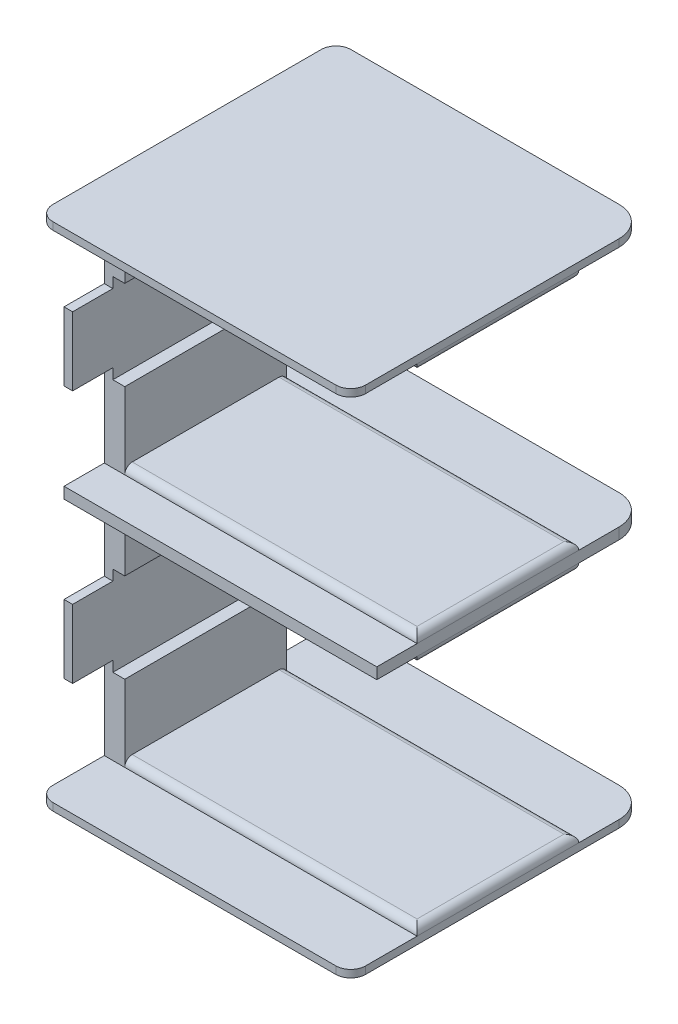
from build123d import *
from OCP.BRepFilletAPI import BRepFilletAPI_MakeFillet

# Parameters (mm, degrees)
SKETCH1_W              = 41.97
SKETCH1_H              = 32.5
BOSS_EXTRUDE1_DEPTH    = 0.75
SKETCH2_W              = 41.97
SKETCH2_H              = 21.7
BOSS_EXTRUDE2_DEPTH    = 1.75
SKETCH4_W              = 2.75
SKETCH4_H              = 21.7
BOSS_EXTRUDE3_DEPTH    = 31.5
SKETCH5_W              = 21.7
SKETCH5_H              = 12
CUT_EXTRUDE1_DEPTH     = 1.6
SKETCH6_W              = 32.5
SKETCH6_H              = 9.2
BOSS_EXTRUDE4_DEPTH    = 1.15
SKETCH7_W              = 41.97
SKETCH7_H              = 21.7
BOSS_EXTRUDE5_DEPTH    = 1
SKETCH8_W              = 41.97
SKETCH8_H              = 40
BOSS_EXTRUDE6_DEPTH    = 1
FILLET1_R              = 4
FILLET1_R_2            = 2
FILLET1_R_3            = 1
FILLET1_OF_MIRROR2_R   = 4
FILLET1_OF_MIRROR2_R_2 = 2
FILLET1_OF_MIRROR2_R_3 = 1
FILLET2_R              = 1
SKETCH9_W              = 41.97
SKETCH9_H              = 1.5
BOSS_EXTRUDE7_DEPTH    = 4
FILLET4_R              = 4
FILLET5_R              = 2


with BuildPart() as part:
    # Sketch1 → Boss-Extrude1 (new, symmetric)
    with BuildSketch(Plane(origin=(0, 0, 0), x_dir=(1, 0, 0), z_dir=(0, 1, 0))):
        Rectangle(SKETCH1_W, SKETCH1_H)
    extrude(amount=BOSS_EXTRUDE1_DEPTH, both=True)

    # Sketch2 → Boss-Extrude2 (add, symmetric)
    with BuildSketch(Plane(origin=(0, 0, 0), x_dir=(1, 0, 0), z_dir=(0, 1, 0))):
        Rectangle(SKETCH2_W, SKETCH2_H)
    extrude(amount=BOSS_EXTRUDE2_DEPTH, both=True)

    # Sketch4 → Boss-Extrude3 (add)
    with BuildSketch(Plane(origin=(0, 0.75, 0), x_dir=(1, 0, 0), z_dir=(0, 1, 0))):
        with Locations((-19.61, 0)):
            Rectangle(SKETCH4_W, SKETCH4_H)
    boss_extrude3 = extrude(amount=BOSS_EXTRUDE3_DEPTH)

    # Sketch5 → Cut-Extrude1 (cut)
    with BuildSketch(Plane(origin=(-18.235, 0, 0), x_dir=(0, 0, -1), z_dir=(1, 0, 0))):
        with Locations((0, 17)):
            Rectangle(SKETCH5_W, SKETCH5_H)
    cut_extrude1 = extrude(amount=-CUT_EXTRUDE1_DEPTH, mode=Mode.SUBTRACT)

    # Sketch6 → Boss-Extrude4 (add)
    with BuildSketch(Plane(origin=(-19.835, 0, 0), x_dir=(0, 0, -1), z_dir=(1, 0, 0))):
        with Locations((0, 17)):
            Rectangle(SKETCH6_W, SKETCH6_H)
    boss_extrude4 = extrude(amount=-BOSS_EXTRUDE4_DEPTH)

    # Sketch7 → Boss-Extrude5 (add)
    with BuildSketch(Plane(origin=(0, 32.25, 0), x_dir=(1, 0, 0), z_dir=(0, 1, 0))):
        Rectangle(SKETCH7_W, SKETCH7_H)
    boss_extrude5 = extrude(amount=BOSS_EXTRUDE5_DEPTH)

    # Sketch8 → Boss-Extrude6 (add)
    with BuildSketch(Plane(origin=(0, 33.25, 0), x_dir=(1, 0, 0), z_dir=(0, 1, 0))):
        with Locations((0, 0.25)):
            Rectangle(SKETCH8_W, SKETCH8_H)
    boss_extrude6 = extrude(amount=BOSS_EXTRUDE6_DEPTH)

    # Fillet1
    fillet1_edges_1 = [part.edges().sort_by_distance(p)[0] for p in [
        (20.985, 33.75, -20.25),
    ]]
    fillet1_edges_2 = [part.edges().sort_by_distance(p)[0] for p in [
        (-20.985, 33.75, -20.25),
        (-20.985, 33.75, 19.75),
        (20.985, 33.75, 19.75),
    ]]
    fillet1_edges_3 = [part.edges().sort_by_distance(p)[0] for p in [
        (20.985, 32.25, 0),
        (1.375, 32.25, 10.85),
        (1.375, 32.25, -10.85),
    ]]
    fillet1 = BRepFilletAPI_MakeFillet(part.part.solid().wrapped)
    for e in fillet1_edges_1:
        fillet1.Add(FILLET1_R - 0.0001, e.wrapped)
    for e in fillet1_edges_2:
        fillet1.Add(FILLET1_R_2 - 0.0001, e.wrapped)
    for e in fillet1_edges_3:
        fillet1.Add(FILLET1_R_3 - 0.0001, e.wrapped)
    add(Compound.cast(fillet1.Shape()), mode=Mode.REPLACE)  # a hair under: the kernel refuses the full size

    # Mirror2: Boss-Extrude3, Cut-Extrude1, Boss-Extrude4, Boss-Extrude5, Boss-Extrude6 across plane
    add(boss_extrude3.mirror(Plane.ZX))
    add(cut_extrude1.mirror(Plane.ZX), mode=Mode.SUBTRACT)
    add(boss_extrude4.mirror(Plane.ZX))
    add(boss_extrude5.mirror(Plane.ZX))
    add(boss_extrude6.mirror(Plane.ZX))

    # Fillet1 of Mirror2
    fillet1_of_mirror2_edges_1 = [part.edges().sort_by_distance(p)[0] for p in [
        (20.985, -33.75, -20.25),
    ]]
    fillet1_of_mirror2_edges_2 = [part.edges().sort_by_distance(p)[0] for p in [
        (-20.985, -33.75, -20.25),
        (-20.985, -33.75, 19.75),
        (20.985, -33.75, 19.75),
    ]]
    fillet1_of_mirror2_edges_3 = [part.edges().sort_by_distance(p)[0] for p in [
        (20.985, -32.25, 0),
        (1.375, -32.25, 10.85),
        (1.375, -32.25, -10.85),
    ]]
    fillet1_of_mirror2 = BRepFilletAPI_MakeFillet(part.part.solid().wrapped)
    for e in fillet1_of_mirror2_edges_1:
        fillet1_of_mirror2.Add(FILLET1_OF_MIRROR2_R - 0.0001, e.wrapped)
    for e in fillet1_of_mirror2_edges_2:
        fillet1_of_mirror2.Add(FILLET1_OF_MIRROR2_R_2 - 0.0001, e.wrapped)
    for e in fillet1_of_mirror2_edges_3:
        fillet1_of_mirror2.Add(FILLET1_OF_MIRROR2_R_3 - 0.0001, e.wrapped)
    add(Compound.cast(fillet1_of_mirror2.Shape()), mode=Mode.REPLACE)  # a hair under: the kernel refuses the full size

    # Fillet2
    fillet2_edges = [part.edges().sort_by_distance(p)[0] for p in [
        (20.985, -1.75, 0),
        (20.985, 1.75, 0),
        (1.375, -1.75, 10.85),
        (1.375, -1.75, -10.85),
        (1.375, 1.75, 10.85),
        (1.375, 1.75, -10.85),
    ]]
    fillet(fillet2_edges, radius=FILLET2_R - 0.0001)  # a hair under: the kernel refuses the full size

    # Sketch9 → Boss-Extrude7 (add)
    with BuildSketch(Plane(origin=(0, 0, -16.25), x_dir=(-1, 0, 0), z_dir=(0, 0, -1))):
        Rectangle(SKETCH9_W, SKETCH9_H)
    extrude(amount=BOSS_EXTRUDE7_DEPTH)

    # Fillet4
    fillet4_edges = [part.edges().sort_by_distance(p)[0] for p in [
        (20.985, 0, -20.25),
    ]]
    fillet(fillet4_edges, radius=FILLET4_R)

    # Fillet5
    fillet5_edges = [part.edges().sort_by_distance(p)[0] for p in [
        (-20.985, 0, -20.25),
    ]]
    fillet(fillet5_edges, radius=FILLET5_R)


solid = part.part
